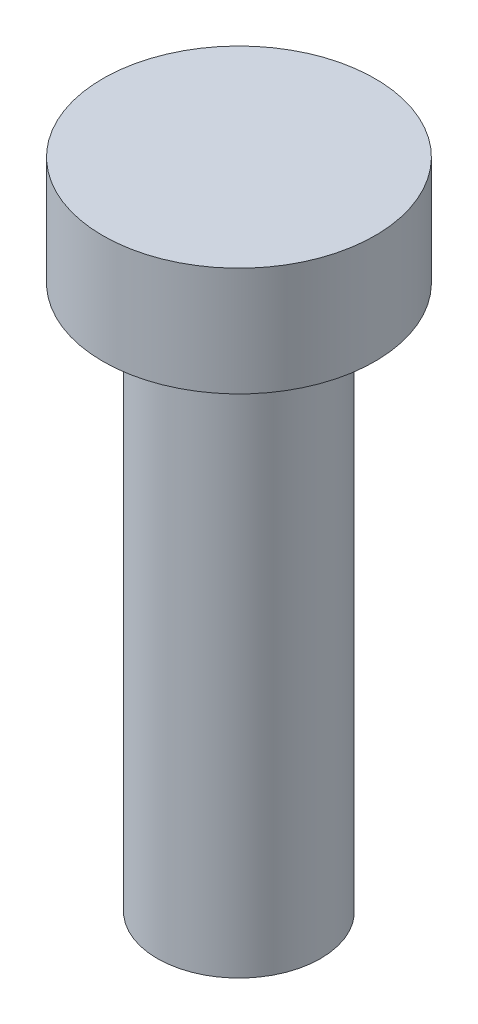
from build123d import *

# Parameters (mm, degrees)
ESQUISSE1_R      = 1.5
EXTRUSION1_DEPTH = 10
ESQUISSE2_R      = 2.5
EXTRUSION2_DEPTH = 2


with BuildPart() as part:
    # Esquisse1 → Extrusion1 (new body)
    with BuildSketch(Plane(origin=(0, 0, 0), x_dir=(1, 0, 0), z_dir=(0, 1, 0))):
        Circle(ESQUISSE1_R)
    extrude(amount=EXTRUSION1_DEPTH)

    # Esquisse2 → Extrusion2 (add)
    with BuildSketch(Plane(origin=(0, 10, 0), x_dir=(1, 0, 0), z_dir=(0, 1, 0))):
        Circle(ESQUISSE2_R)
    extrude(amount=EXTRUSION2_DEPTH)


solid = part.part
